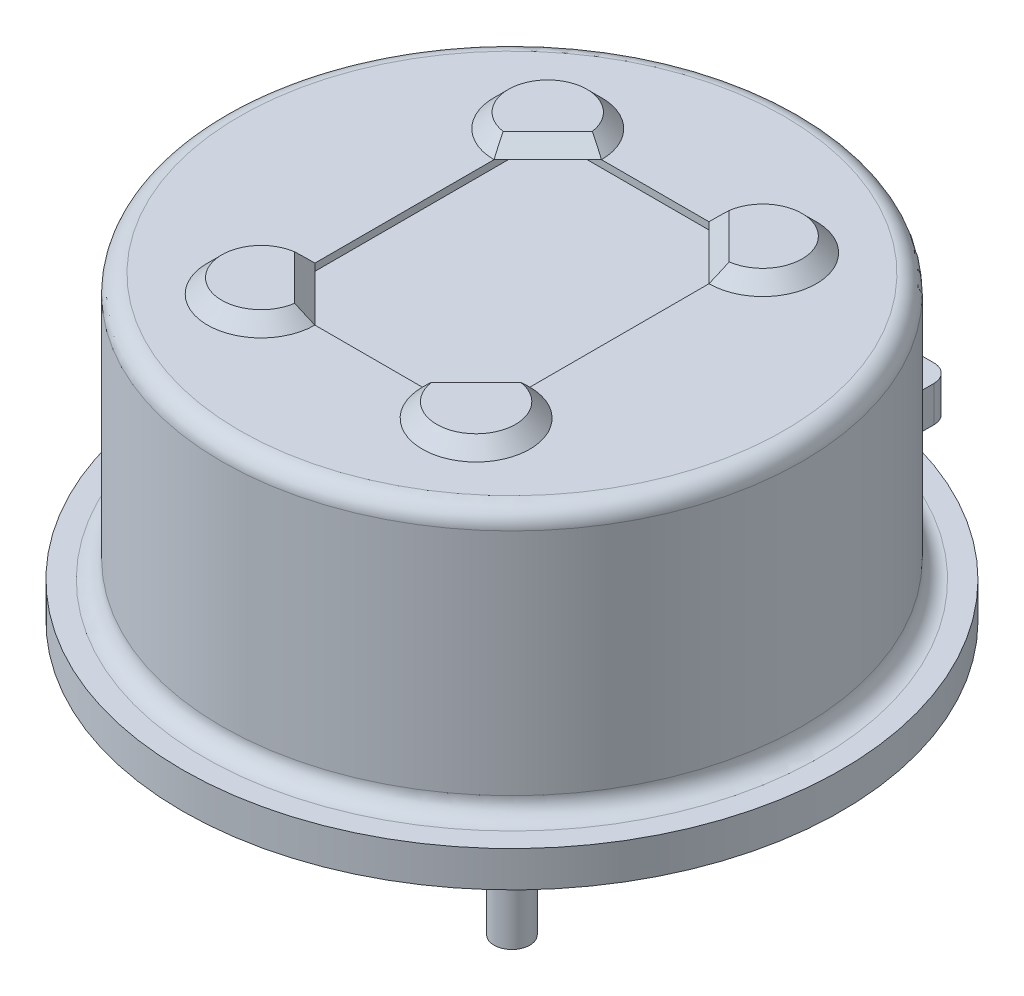
from build123d import *

# Parameters (mm, degrees)
SKETCH1_R                   = 4.05
BASE_EXTRUSION_DEPTH        = 4.2
SKETCH2_W                   = 3
SKETCH2_H                   = 4
WINDOW_DEPTH                = 0.1
WINDOW_BUMPS_DEPTH          = 0.2
WINDOW_BUMPS_CHAMFERS_SIZE  = 0.2
SKETCH3_R                   = 4.6
FLANGE_DEPTH                = 0.5
SKETCH5_W                   = 1.15
SKETCH5_H                   = 1
HORIZONTAL_FLANGE_TAB_DEPTH = 0.5
ROUNDS_AND_FILLETS_R        = 0.25
SKETCH4_R                   = 0.25
LEADS_DEPTH                 = 13.2


with BuildPart() as part:
    # Sketch1 → Base Extrusion (new body)
    with BuildSketch(Plane(origin=(0, 0, 0), x_dir=(1, 0, 0), z_dir=(0, 1, 0))):
        with Locations(Location((0, 0, 0), (0, 0, 270))):
            Circle(SKETCH1_R)
    extrude(amount=BASE_EXTRUSION_DEPTH)

    # Sketch2 → Window (cut)
    with BuildSketch(Plane(origin=(0, 4.2, 0), x_dir=(1, 0, 0), z_dir=(0, 1, 0))):
        Rectangle(SKETCH2_W, SKETCH2_H)
    extrude(amount=-WINDOW_DEPTH, mode=Mode.SUBTRACT)

    # Sketch6 → Window Bumps (add)
    with BuildSketch(Plane(origin=(0, 4.2, 0), x_dir=(1, 0, 0), z_dir=(0, 1, 0))):
        with BuildLine():
            Line((-0.75, 2), (-1.5, 1.25))
            ThreePointArc((-1.5, 1.25), (-2.030330086, 2.530330086), (-0.75, 2))
        make_face()
        with BuildLine():
            Line((0.75, 2), (1.5, 1.25))
            ThreePointArc((1.5, 1.25), (2.030330086, 2.530330086), (0.75, 2))
        make_face()
        with BuildLine():
            Line((1.5, -1.25), (0.75, -2))
            ThreePointArc((0.75, -2), (2.030330086, -2.530330086), (1.5, -1.25))
        make_face()
        with BuildLine():
            Line((-1.5, -1.25), (-0.75, -2))
            ThreePointArc((-0.75, -2), (-2.030330086, -2.530330086), (-1.5, -1.25))
        make_face()
    extrude(amount=WINDOW_BUMPS_DEPTH)

    # Window Bumps Chamfers
    window_bumps_chamfers_edges = [part.edges().sort_by_distance(p)[0] for p in [
        (-2.030330086, 4.4, 2.530330086),
        (2.030330086, 4.4, 2.530330086),
        (2.030330086, 4.4, -2.530330086),
        (-2.030330086, 4.4, -2.530330086),
        (-1.125, 4.4, 1.625),
        (1.125, 4.4, 1.625),
        (1.125, 4.4, -1.625),
        (-1.125, 4.4, -1.625),
    ]]
    chamfer(window_bumps_chamfers_edges, length=WINDOW_BUMPS_CHAMFERS_SIZE - 0.0001)  # a hair under: the kernel refuses the full size

    # Sketch3 → Flange (add)
    with BuildSketch(Plane.XZ):
        with Locations(Location((0, 0, 0), (0, 0, 270))):
            Circle(SKETCH3_R)
    extrude(amount=-FLANGE_DEPTH)

    # Sketch5 → Horizontal Flange Tab (add)
    with BuildSketch(Plane.XZ):
        with Locations((0, -5.063921012)):
            Rectangle(SKETCH5_W, SKETCH5_H)
    extrude(amount=-HORIZONTAL_FLANGE_TAB_DEPTH)

    # Rounds and Fillets
    rounds_and_fillets_edges = [part.edges().sort_by_distance(p)[0] for p in [
        (0, 4.2, -4.05),
        (0, 0.5, -4.05),
        (-0.575, 0.25, -5.563921012),
        (0.575, 0.25, -5.563921012),
    ]]
    fillet(rounds_and_fillets_edges, radius=ROUNDS_AND_FILLETS_R)

    # Sketch4 → Leads (add)
    with BuildSketch(Plane.XZ):
        with Locations(Location((-1.796051224, -1.796051224, 0), (0, 0, 90))):
            Circle(SKETCH4_R)
        with Locations(Location((1.796051224, 1.796051224, 0), (0, 0, 90))):
            Circle(SKETCH4_R)
        with Locations(Location((-1.796051224, 1.796051224, 0), (0, 0, 90))):
            Circle(SKETCH4_R)
    extrude(amount=LEADS_DEPTH)

    # Leads Trim
    split(bisect_by=Plane(origin=(0, -2, 0), x_dir=(1, 0, 0), z_dir=(0, 1, 0)), keep=Keep.TOP)


solid = part.part
